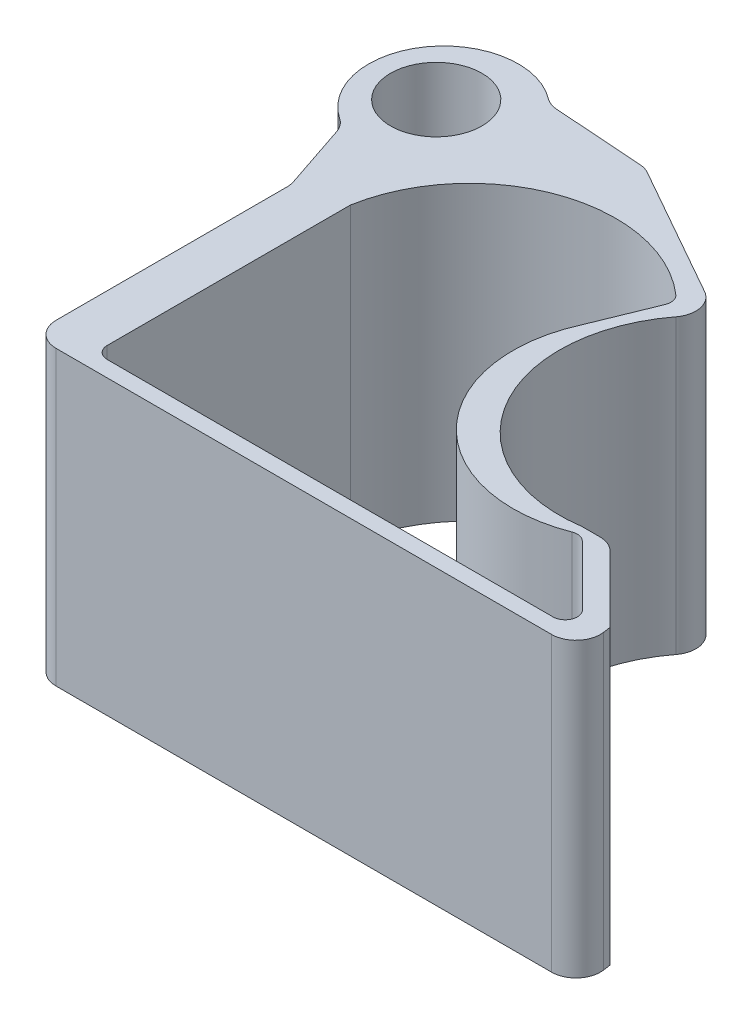
from build123d import *

# Parameters (mm, degrees)
SKETCH1_R           = 4.7625
BOSS_EXTRUDE2_DEPTH = 30.48
FILLET1_R           = 2.54


with BuildPart() as part:
    # Sketch1 → Boss-Extrude2 (new body)
    with BuildSketch(Plane(origin=(0, 0, 0), x_dir=(1, 0, 0), z_dir=(0, 1, 0))):
        with BuildLine():
            Line((22.451182043, 35.66511967), (5.377854414, 45.31005212))
            Line((5.377854414, 45.31005212), (-5.367910813, 46.064153357))
            ThreePointArc((-5.367910813, 46.064153357), (-17.000257473, 44.802695642), (-14.280396301, 33.422664026))
            Line((-14.280396301, 33.422664026), (-11.575660389, 25.36121668))
            Line((-11.575660389, 25.36121668), (-11.575660389, -1.656575462))
            Line((-11.575660389, -1.656575462), (45.515150945, -1.656575462))
            Line((45.515150945, -1.656575462), (45.005946436, 2.027668921))
            Line((45.005946436, 2.027668921), (37.367878813, 9.665736544))
            Line((37.367878813, 9.665736544), (34.432464589, 9.665736544))
            ThreePointArc((34.432464589, 9.665736544), (18.704388059, 18.178130753), (22.451182043, 35.66511967))
        make_face()
        with BuildLine():
            ThreePointArc((34.418608086, 8.652550432), (35.139277633, 8.711596588), (35.775365429, 8.367731265))
            Line((35.775365429, 8.367731265), (41.988123028, 2.169043017))
            ThreePointArc((41.988123028, 2.169043017), (42.264718256, 0.784657148), (41.091115974, 0))
            Line((41.091115974, 0), (-5.367910813, 0))
            ThreePointArc((-5.367910813, 0), (-6.265936425, 0.371974388), (-6.637910813, 1.27))
            Line((-6.637910813, 1.27), (-6.637910813, 26.607611872))
            ThreePointArc((-6.637910813, 26.607611872), (3.288167743, 38.370043483), (18.405670977, 35.481630621))
            ThreePointArc((18.405670977, 35.481630621), (18.80575079, 34.818433424), (18.746230839, 34.046195278))
            Line((18.746230839, 34.046195278), (16.202668925, 27.801375987))
            ThreePointArc((16.202668925, 27.801375987), (18.894618686, 12.123517004), (34.418608086, 8.652550432))
        make_face(mode=Mode.SUBTRACT)
        with Locations((-11.678835755, 40.598351677)):
            Circle(SKETCH1_R, mode=Mode.SUBTRACT)
    extrude(amount=BOSS_EXTRUDE2_DEPTH)

    # Fillet1
    fillet1_edges = [part.edges().sort_by_distance(p)[0] for p in [
        (5.377854414, 15.24, -45.31005212),
        (-5.367910813, 15.24, -46.064153357),
        (-14.280396301, 15.24, -33.422664026),
        (-11.575660389, 15.24, -25.36121668),
        (-11.575660389, 15.24, 1.656575462),
        (45.515150945, 15.24, 1.656575462),
        (37.367878813, 15.24, -9.665736544),
        (22.451182043, 15.24, -35.66511967),
    ]]
    fillet(fillet1_edges, radius=FILLET1_R)


solid = part.part
